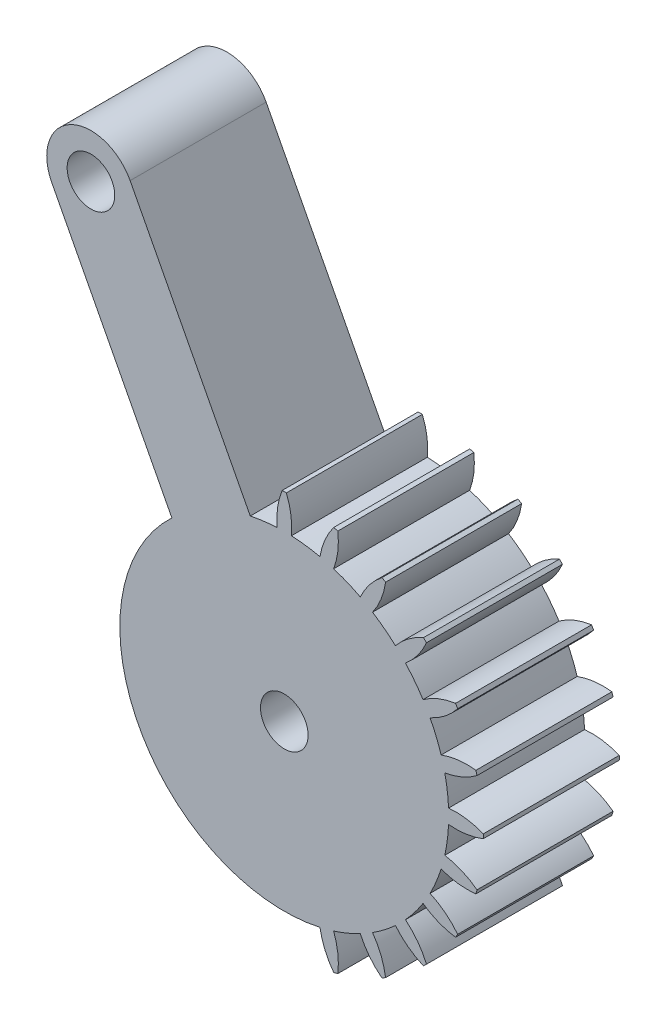
from build123d import *

# Parameters (mm, degrees)
SKETCH1_R           = 1.75
BOSS_EXTRUDE1_DEPTH = 10


with BuildPart() as part:
    # Sketch1 → Boss-Extrude1 (new body)
    with BuildSketch(Plane.XY):
        with BuildLine():
            Line((0.155, 14.63), (-0.155, 14.63))
            ThreePointArc((-0.155, 14.63), (-0.491925829, 13.37649981), (-0.52, 12.078812028))
            ThreePointArc((-0.52, 12.078812028), (-1.515917744, 11.994586003), (-2.50147536, 11.828386239))
            Line((-2.50147536, 11.828386239), (-11.333513235, 28.769367003))
            ThreePointArc((-11.333513235, 28.769367003), (-15.717822608, 30.148798524), (-17.097254129, 25.764489151))
            Line((-17.097254129, 25.764489151), (-8.265216255, 8.823508388))
            ThreePointArc((-8.265216255, 8.823508388), (-10.691447625, -5.644559122), (2.623945165, -11.801822392))
            ThreePointArc((2.623945165, -11.801822392), (2.986929045, -13.048026405), (3.636804127, -14.171611791))
            Line((3.636804127, -14.171611791), (3.936241133, -14.091377887))
            ThreePointArc((3.936241133, -14.091377887), (3.937256771, -12.793386859), (3.628508025, -11.532650585))
            ThreePointArc((3.628508025, -11.532650585), (4.626642697, -11.169703548), (5.589072804, -10.720558064))
            ThreePointArc((5.589072804, -10.720558064), (6.26222964, -11.830351564), (7.180766062, -12.747451657))
            Line((7.180766062, -12.747451657), (7.449233938, -12.592451657))
            ThreePointArc((7.449233938, -12.592451657), (7.11427017, -11.338425735), (6.489739224, -10.200558064))
            ThreePointArc((6.489739224, -10.200558064), (7.359925677, -9.591641884), (8.173314367, -8.90870542))
            ThreePointArc((8.173314367, -8.90870542), (9.110769635, -9.806457814), (10.235370658, -10.45457376))
            Line((10.235370658, -10.45457376), (10.45457376, -10.235370658))
            ThreePointArc((10.45457376, -10.235370658), (9.806457814, -9.110769635), (8.90870542, -8.173314367))
            ThreePointArc((8.90870542, -8.173314367), (9.591641884, -7.359925677), (10.200558064, -6.489739224))
            ThreePointArc((10.200558064, -6.489739224), (11.338425735, -7.11427017), (12.592451657, -7.449233938))
            Line((12.592451657, -7.449233938), (12.747451657, -7.180766062))
            ThreePointArc((12.747451657, -7.180766062), (11.830351564, -6.26222964), (10.720558064, -5.589072804))
            ThreePointArc((10.720558064, -5.589072804), (11.169703548, -4.626642697), (11.532650585, -3.628508025))
            ThreePointArc((11.532650585, -3.628508025), (12.793386859, -3.937256771), (14.091377887, -3.936241133))
            Line((14.091377887, -3.936241133), (14.171611791, -3.636804127))
            ThreePointArc((14.171611791, -3.636804127), (13.048026405, -2.986929045), (11.801822392, -2.623945165))
            ThreePointArc((11.801822392, -2.623945165), (11.986568374, -1.578061664), (12.078812028, -0.52))
            ThreePointArc((12.078812028, -0.52), (13.37649981, -0.491925829), (14.63, -0.155))
            Line((14.63, -0.155), (14.63, 0.155))
            ThreePointArc((14.63, 0.155), (13.37649981, 0.491925829), (12.078812028, 0.52))
            ThreePointArc((12.078812028, 0.52), (11.986568374, 1.578061664), (11.801822392, 2.623945165))
            ThreePointArc((11.801822392, 2.623945165), (13.048026405, 2.986929045), (14.171611791, 3.636804127))
            Line((14.171611791, 3.636804127), (14.091377887, 3.936241133))
            ThreePointArc((14.091377887, 3.936241133), (12.793386859, 3.937256771), (11.532650585, 3.628508025))
            ThreePointArc((11.532650585, 3.628508025), (11.169703548, 4.626642697), (10.720558064, 5.589072804))
            ThreePointArc((10.720558064, 5.589072804), (11.830351564, 6.26222964), (12.747451657, 7.180766062))
            Line((12.747451657, 7.180766062), (12.592451657, 7.449233938))
            ThreePointArc((12.592451657, 7.449233938), (11.338425735, 7.11427017), (10.200558064, 6.489739224))
            ThreePointArc((10.200558064, 6.489739224), (9.591641884, 7.359925677), (8.90870542, 8.173314367))
            ThreePointArc((8.90870542, 8.173314367), (9.806457814, 9.110769635), (10.45457376, 10.235370658))
            Line((10.45457376, 10.235370658), (10.235370658, 10.45457376))
            ThreePointArc((10.235370658, 10.45457376), (9.110769635, 9.806457814), (8.173314367, 8.90870542))
            ThreePointArc((8.173314367, 8.90870542), (7.359925677, 9.591641884), (6.489739224, 10.200558064))
            ThreePointArc((6.489739224, 10.200558064), (7.11427017, 11.338425735), (7.449233938, 12.592451657))
            Line((7.449233938, 12.592451657), (7.180766062, 12.747451657))
            ThreePointArc((7.180766062, 12.747451657), (6.26222964, 11.830351564), (5.589072804, 10.720558064))
            ThreePointArc((5.589072804, 10.720558064), (4.626642697, 11.169703548), (3.628508025, 11.532650585))
            ThreePointArc((3.628508025, 11.532650585), (3.937256771, 12.793386859), (3.936241133, 14.091377887))
            Line((3.936241133, 14.091377887), (3.636804127, 14.171611791))
            ThreePointArc((3.636804127, 14.171611791), (2.986929045, 13.048026405), (2.623945165, 11.801822392))
            ThreePointArc((2.623945165, 11.801822392), (1.578061664, 11.986568374), (0.52, 12.078812028))
            ThreePointArc((0.52, 12.078812028), (0.491925829, 13.37649981), (0.155, 14.63))
        make_face()
        Circle(SKETCH1_R, mode=Mode.SUBTRACT)
        with Locations((-14.215383682, 27.266928077)):
            Circle(SKETCH1_R, mode=Mode.SUBTRACT)
    extrude(amount=-BOSS_EXTRUDE1_DEPTH)


solid = part.part
